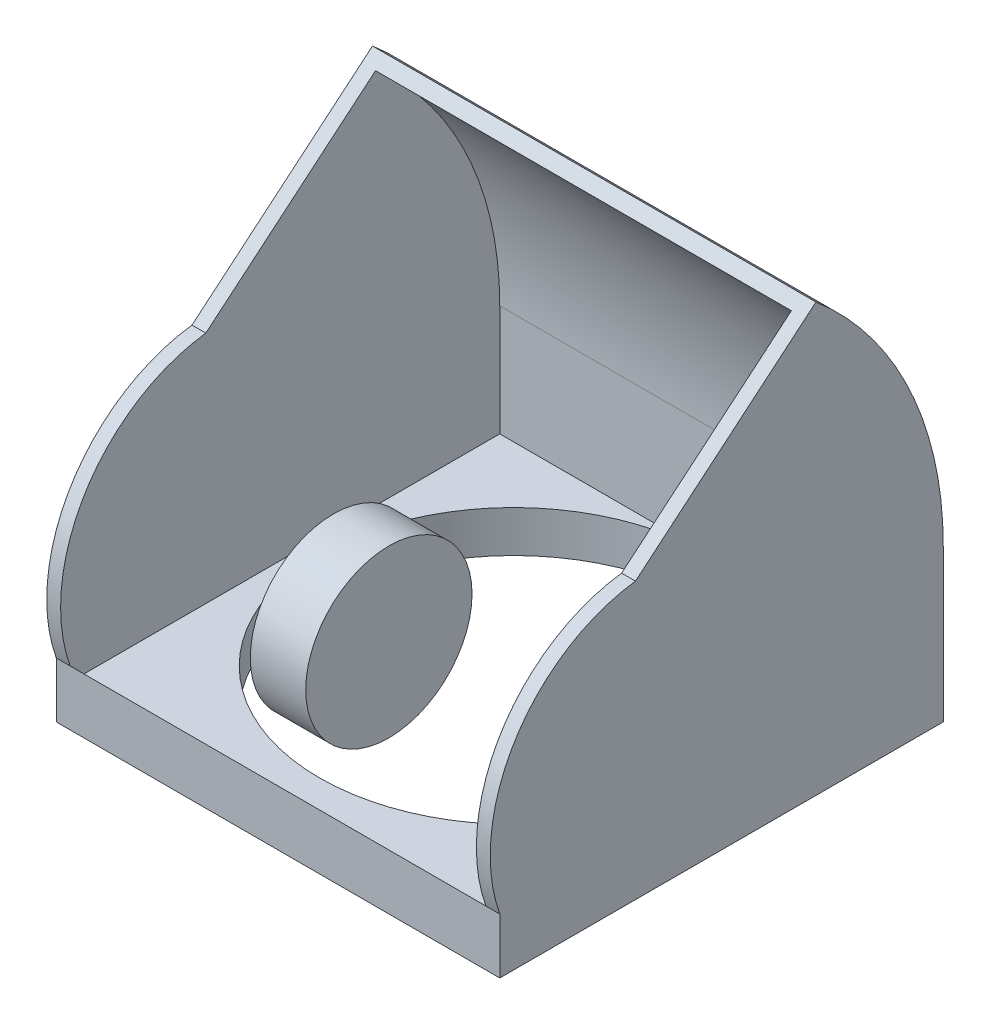
from build123d import *

# Parameters (mm, degrees)
SKETCH2_W           = 203.2
SKETCH2_H           = 203.2
BOSS_EXTRUDE1_DEPTH = 25.4
BOSS_EXTRUDE2_DEPTH = 203.2
SHELL1_START        = -95.25
SHELL1_DEPTH        = 190.5
SKETCH6_R           = 38.1
BOSS_EXTRUDE3_DEPTH = 12.7
SKETCH7_R           = 88.9
CUT_EXTRUDE1_DEPTH  = 230.741261845


# Read off the part's stored shape, not the designer's step: Shell1
with BuildPart() as part:
    # Sketch2 → Boss-Extrude1 (new body)
    with BuildSketch(Plane(origin=(0, 0, 0), x_dir=(1, 0, 0), z_dir=(0, 1, 0))):
        Rectangle(SKETCH2_W, SKETCH2_H)
    extrude(amount=BOSS_EXTRUDE1_DEPTH)

    # Sketch3 → Boss-Extrude2 (add)
    with BuildSketch(Plane(origin=(101.6, 0, 0), x_dir=(0, 0, -1), z_dir=(1, 0, 0))):
        with BuildLine():
            Line((-101.6, 25.4), (101.6, 25.4))
            Line((101.6, 25.4), (101.6, 69.85))
            ThreePointArc((101.6, 69.85), (86.311122378, 139.237589754), (43.276104035, 195.774078742))
            Line((43.276104035, 195.774078742), (-39.4183936, 126.385156277))
            ThreePointArc((-39.4183936, 126.385156277), (-94.643731282, 90.753416891), (-101.6, 25.4))
        make_face()
    extrude(amount=-BOSS_EXTRUDE2_DEPTH)

    # Shell1 outline → Shell1 (cut)
    with BuildSketch(Plane.YZ.offset(SHELL1_START)):
        with BuildLine():
            Line((19.05, -95.25), (69.85, -95.25))
            ThreePointArc((69.85, -95.25), (137.061401768, -80.31999156), (191.630702174, -38.338220124))
            Line((191.630702174, -38.338220124), (126.385156277, 39.4183936))
            ThreePointArc((126.385156277, 39.4183936), (90.753416891, 94.643731282), (25.4, 101.6))
            ThreePointArc((25.4, 101.6), (22.196082961, 100.385537214), (19.05, 99.028272959))
            Line((19.05, 99.028272959), (19.05, -95.25))
        make_face()
    extrude(amount=SHELL1_DEPTH, mode=Mode.SUBTRACT)

    # Sketch7 → Cut-Extrude1 (cut, through all)
    with BuildSketch(Plane(origin=(0, 19.05, 0), x_dir=(1, 0, 0), z_dir=(0, 1, 0))):
        with Locations(Location((0, 6.35, 0), (0, 0, 270))):
            Circle(SKETCH7_R)
    extrude(amount=-CUT_EXTRUDE1_DEPTH, mode=Mode.SUBTRACT)


with BuildPart() as body_2:
    # Sketch6 → Boss-Extrude3 (new, symmetric)
    with BuildSketch(Plane(origin=(0, 0, 0), x_dir=(0, 0, -1), z_dir=(1, 0, 0))):
        with Locations((-63.5, 69.85)):
            Circle(SKETCH6_R)
    extrude(amount=BOSS_EXTRUDE3_DEPTH, both=True)


solid = Compound([part.part, body_2.part])
